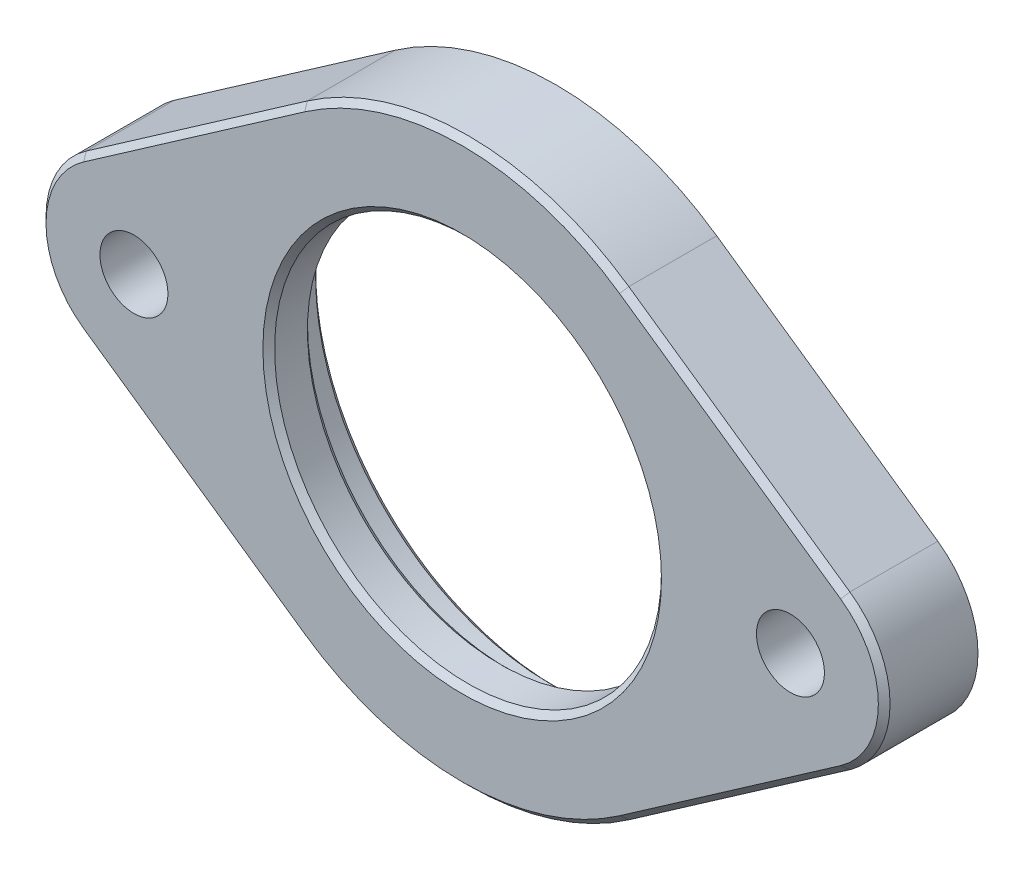
from build123d import *

# Parameters (mm, degrees)
BOSS_EXTRUDE1_DEPTH     = 4
CUT_EXTRUDE1_DEPTH      = 23
CUT_EXTRUDE1_DEPTH_BACK = 23
SKETCH1_4_R             = 8.25
CUT_EXTRUDE2_DEPTH      = 2.1
CUT_EXTRUDE2_DEPTH_BACK = 23
SKETCH1_6_R             = 10
M2_5_CLEARANCE_HOLE1_D  = 2.9
CHAMFER1_SIZE           = 0.25


with BuildPart() as part:
    # Sketch1 → Boss-Extrude1 (new body)
    with BuildSketch(Plane.XY):
        with BuildLine():
            ThreePointArc((6.857142857, 9.84782168), (0, 12), (-6.857142857, 9.84782168))
            Line((-6.857142857, 9.84782168), (-16.285714286, 3.282607227))
            ThreePointArc((-16.285714286, 3.282607227), (-18, 0), (-16.285714286, -3.282607227))
            Line((-16.285714286, -3.282607227), (-6.857142857, -9.84782168))
            ThreePointArc((-6.857142857, -9.84782168), (0, -12), (6.857142857, -9.84782168))
            Line((6.857142857, -9.84782168), (16.285714286, -3.282607227))
            ThreePointArc((16.285714286, -3.282607227), (18, 0), (16.285714286, 3.282607227))
            Line((16.285714286, 3.282607227), (6.857142857, 9.84782168))
        make_face()
    extrude(amount=BOSS_EXTRUDE1_DEPTH)

    # Sketch1<4> → Cut-Extrude1 (cut, two sides: drawn at the far end of the back side and taken through both)
    with BuildSketch(Plane.XY.offset(-CUT_EXTRUDE1_DEPTH_BACK)):
        Circle(SKETCH1_4_R)
    extrude(amount=CUT_EXTRUDE1_DEPTH + CUT_EXTRUDE1_DEPTH_BACK, mode=Mode.SUBTRACT)

    # Sketch1<6> → Cut-Extrude2 (cut, two sides: drawn at the far end of the back side and taken through both)
    with BuildSketch(Plane.XY.offset(-CUT_EXTRUDE2_DEPTH_BACK)):
        Circle(SKETCH1_6_R)
    extrude(amount=CUT_EXTRUDE2_DEPTH + CUT_EXTRUDE2_DEPTH_BACK, mode=Mode.SUBTRACT)

    # M2.5 Clearance Hole1 (through all)
    with Locations(Plane.XY.offset(4)):
        with Locations((-14, 0), (14, 0)):
            Hole(M2_5_CLEARANCE_HOLE1_D / 2)

    # Chamfer1
    chamfer1_edges = [part.edges().sort_by_distance(p)[0] for p in [
        (-8.25, 0, 4),
        (-8.25, 0, 2.1),
        (-10, 0, 0),
        (-10, 0, 2.1),
        (0, -12, 4),
        (11.571428571, -6.565214453, 4),
        (-11.571428571, -6.565214453, 4),
        (18, 0, 4),
        (-18, 0, 4),
        (11.571428571, 6.565214453, 4),
        (-11.571428571, 6.565214453, 4),
        (0, 12, 4),
    ]]
    chamfer(chamfer1_edges, length=CHAMFER1_SIZE)


solid = part.part
